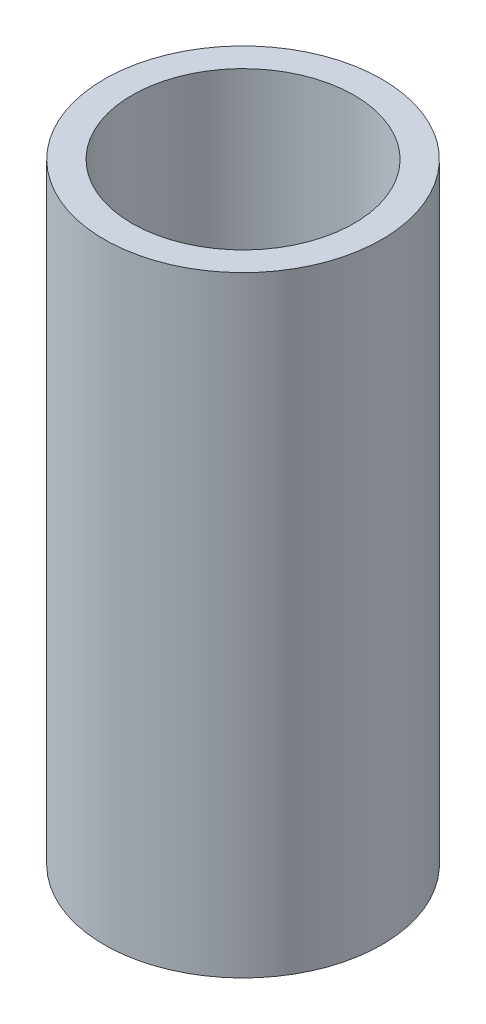
from build123d import *

# Parameters (mm, degrees)
SKETCH1_W = 1.5
SKETCH1_H = 33


with BuildPart() as part:
    # Sketch1 → Revolve1 (revolve)
    with BuildSketch(Plane.XY):
        with Locations((6.75, 16.5)):
            Rectangle(SKETCH1_W, SKETCH1_H)
    revolve(axis=Axis((0, 0, 0), (0, 1, 0)))


solid = part.part
